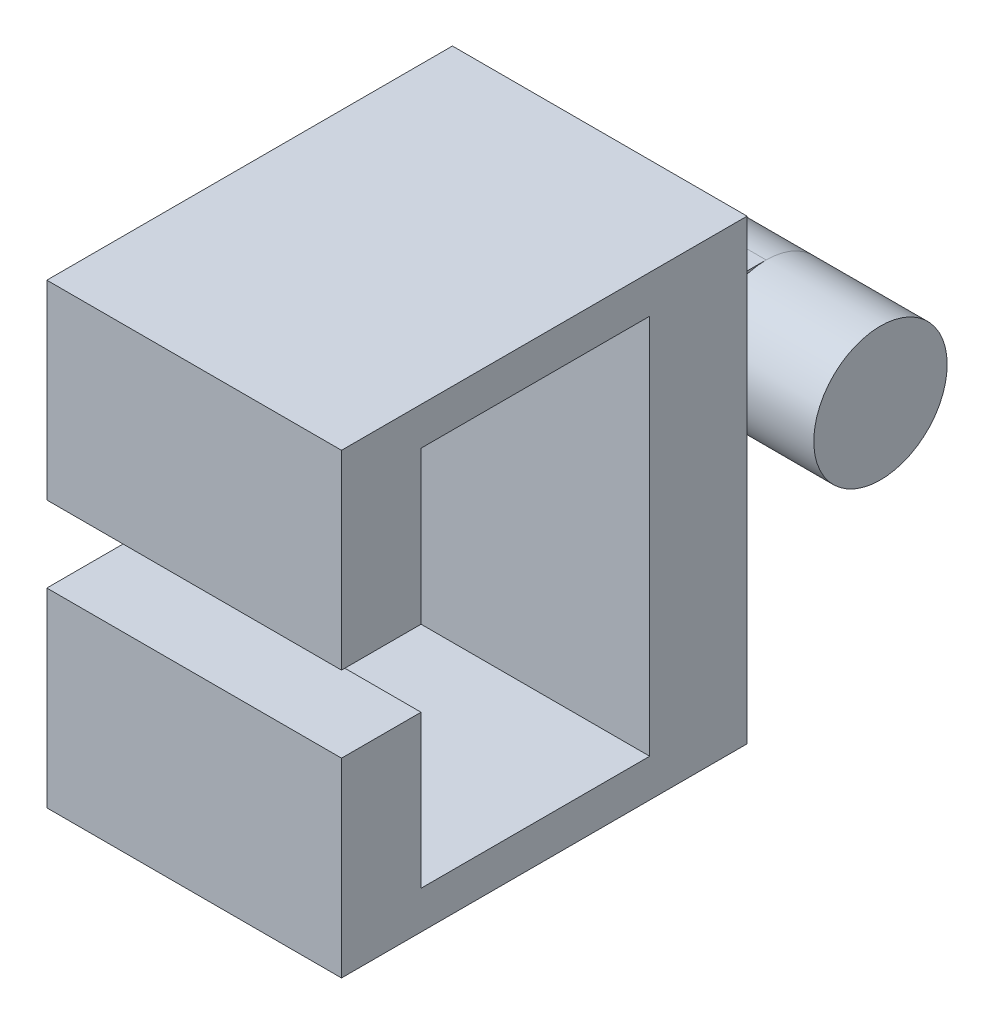
from build123d import *

# Parameters (mm, degrees)
BASE_SKETCH_R      = 11.112869807
FEATURE_A_DEPTH    = 9.525
FEATURE_B_SKETCH_W = 22.225739614
FEATURE_B_SKETCH_H = 33.338609421
FEATURE_B_DEPTH    = 30.049455477
FILLET1_R          = 11.112869807
FILLET2_R          = 11.112869807
FEATURE_C_SKETCH_W = 76.1492
FEATURE_C_SKETCH_H = 16.225263269
FEATURE_C_DEPTH    = 49.099455477
FEATURE_D_SKETCH_W = 6.3246
FEATURE_D_SKETCH_H = 38.1
FEATURE_D_DEPTH    = 49.099455
FEATURE_E_SKETCH_W = 31.7246
FEATURE_E_SKETCH_H = 13.25229015
FEATURE_E_DEPTH    = 49.099455477
FILLET_BC_R        = 9.525


with BuildPart() as part:
    # Base Sketch → Feature A (new, symmetric)
    with BuildSketch(Plane.YZ):
        with Locations(Location((0, -22.225739614, 0), (0, 0, 90))):
            Circle(BASE_SKETCH_R)
    extrude(amount=FEATURE_A_DEPTH, both=True)

    # Feature B Sketch → Feature B (add)
    with BuildSketch(Plane(origin=(-9.525, 0, 0), x_dir=(0, -1, 0), z_dir=(-1, 0, 0))):
        with Locations((0, -16.669304711)):
            Rectangle(FEATURE_B_SKETCH_W, FEATURE_B_SKETCH_H)
    extrude(amount=FEATURE_B_DEPTH)

    # Fillet1
    fillet1_edges = [part.edges().sort_by_distance(p)[0] for p in [
        (-24.549727739, 11.112869807, -33.338609421),
    ]]
    fillet(fillet1_edges, radius=FILLET1_R - 0.0001)  # a hair under: the kernel refuses the full size

    # Fillet2
    fillet2_edges = [part.edges().sort_by_distance(p)[0] for p in [
        (-24.549727739, -11.112869807, -33.338609421),
    ]]
    fillet(fillet2_edges, radius=FILLET2_R)

    # Feature C Sketch → Feature C (add)
    with BuildSketch(Plane.YZ.offset(9.525)):
        with Locations((0, 8.112631635)):
            Rectangle(FEATURE_C_SKETCH_W, FEATURE_C_SKETCH_H)
    extrude(amount=-FEATURE_C_DEPTH)

    # Feature D Sketch → Feature D (add)
    with BuildSketch(Plane.YZ.offset(9.525)):
        with Locations((34.9123, 35.275263269)):
            Rectangle(FEATURE_D_SKETCH_W, FEATURE_D_SKETCH_H)
        with Locations((-34.9123, 35.275263269)):
            Rectangle(FEATURE_D_SKETCH_W, FEATURE_D_SKETCH_H)
    extrude(amount=-FEATURE_D_DEPTH)

    # Feature E Sketch → Feature E (add)
    with BuildSketch(Plane.YZ.offset(9.525)):
        with Locations((22.2123, 60.951408344)):
            Rectangle(FEATURE_E_SKETCH_W, FEATURE_E_SKETCH_H)
        with Locations((-22.2123, 60.951408344)):
            Rectangle(FEATURE_E_SKETCH_W, FEATURE_E_SKETCH_H)
    extrude(amount=-FEATURE_E_DEPTH)

    # Fillet_BC
    fillet_bc_edges = [part.edges().sort_by_distance(p)[0] for p in [
        (-9.525, 0, 0),
        (-24.549727739, -11.112869807, 0),
        (-24.549727739, 11.112869807, 0),
    ]]
    fillet(fillet_bc_edges, radius=FILLET_BC_R)


solid = part.part
